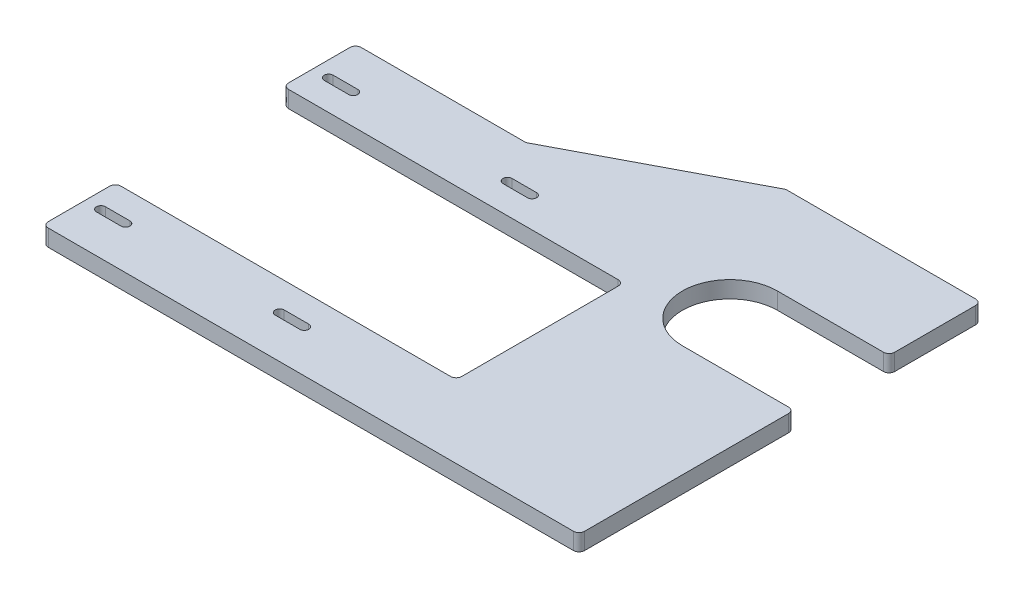
from build123d import *

# Parameters (mm, degrees)
BOSS_EXTRUDE1_DEPTH            = 9.525
F_7_0_201_DIAMETER_SLOT1_DEPTH = 9.525
FILLET1_R                      = 3.175


# Read off the part's stored shape, not the designer's step: #7 (0.201) Diameter Slot1
with BuildPart() as part:
    # Sketch1 → Boss-Extrude1 (new body)
    with BuildSketch(Plane(origin=(0, 0, 0), x_dir=(1, 0, 0), z_dir=(0, 1, 0))):
        with BuildLine():
            Line((0, 0), (304.8, 0))
            Line((304.8, 0), (304.8, 122.2375))
            Line((304.8, 122.2375), (241.3, 122.2375))
            ThreePointArc((241.3, 122.2375), (214.3125, 149.225), (241.3, 176.2125))
            Line((241.3, 176.2125), (304.8, 176.2125))
            Line((304.8, 176.2125), (304.8, 228.6))
            Line((304.8, 228.6), (193.694523922, 228.6))
            Line((193.694523922, 228.6), (96.847261961, 177.8))
            Line((96.847261961, 177.8), (0, 177.8))
            Line((0, 177.8), (0, 136.525))
            Line((0, 136.525), (193.694523922, 136.525))
            Line((193.694523922, 136.525), (193.694523922, 41.275))
            Line((193.694523922, 41.275), (0, 41.275))
            Line((0, 41.275), (0, 0))
        make_face()
    extrude(amount=BOSS_EXTRUDE1_DEPTH)

    # #7 (0.201) Diameter Slot1 outline → #7 (0.201) Diameter Slot1 (cut)
    with BuildSketch(Plane(origin=(0, 0, 0), x_dir=(1, 0, 0), z_dir=(0, 1, 0))):
        with BuildLine():
            Line((8.922223922, 151.076161), (22.866823922, 151.076161))
            ThreePointArc((22.866823922, 151.076161), (25.419523922, 153.628861), (22.866823922, 156.181561))
            Line((22.866823922, 156.181561), (8.922223922, 156.181561))
            ThreePointArc((8.922223922, 156.181561), (6.369523922, 153.628861), (8.922223922, 151.076161))
        make_face()
        with BuildLine():
            ThreePointArc((124.466823922, 151.076161), (127.019523922, 153.628861), (124.466823922, 156.181561))
            Line((124.466823922, 156.181561), (110.522223922, 156.181561))
            ThreePointArc((110.522223922, 156.181561), (107.969523922, 153.628861), (110.522223922, 151.076161))
            Line((110.522223922, 151.076161), (124.466823922, 151.076161))
        make_face()
        with BuildLine():
            Line((8.922223922, 21.618439), (22.866823922, 21.618439))
            ThreePointArc((22.866823922, 21.618439), (25.419523922, 24.171139), (22.866823922, 26.723839))
            Line((22.866823922, 26.723839), (8.922223922, 26.723839))
            ThreePointArc((8.922223922, 26.723839), (6.369523922, 24.171139), (8.922223922, 21.618439))
        make_face()
        with BuildLine():
            ThreePointArc((124.466823922, 21.618439), (127.019523922, 24.171139), (124.466823922, 26.723839))
            Line((124.466823922, 26.723839), (110.522223922, 26.723839))
            ThreePointArc((110.522223922, 26.723839), (107.969523922, 24.171139), (110.522223922, 21.618439))
            Line((110.522223922, 21.618439), (124.466823922, 21.618439))
        make_face()
    extrude(amount=F_7_0_201_DIAMETER_SLOT1_DEPTH, mode=Mode.SUBTRACT)

    # Fillet1
    fillet1_edges = [part.edges().sort_by_distance(p)[0] for p in [
        (0, 4.7625, -41.275),
        (193.694523922, 4.7625, -41.275),
        (193.694523922, 4.7625, -136.525),
        (0, 4.7625, -136.525),
        (0, 4.7625, -177.8),
        (96.847261961, 4.7625, -177.8),
        (193.694523922, 4.7625, -228.6),
        (304.8, 4.7625, -228.6),
        (304.8, 4.7625, -176.2125),
        (304.8, 4.7625, -122.2375),
        (304.8, 4.7625, 0),
        (0, 4.7625, 0),
    ]]
    fillet(fillet1_edges, radius=FILLET1_R)


solid = part.part
